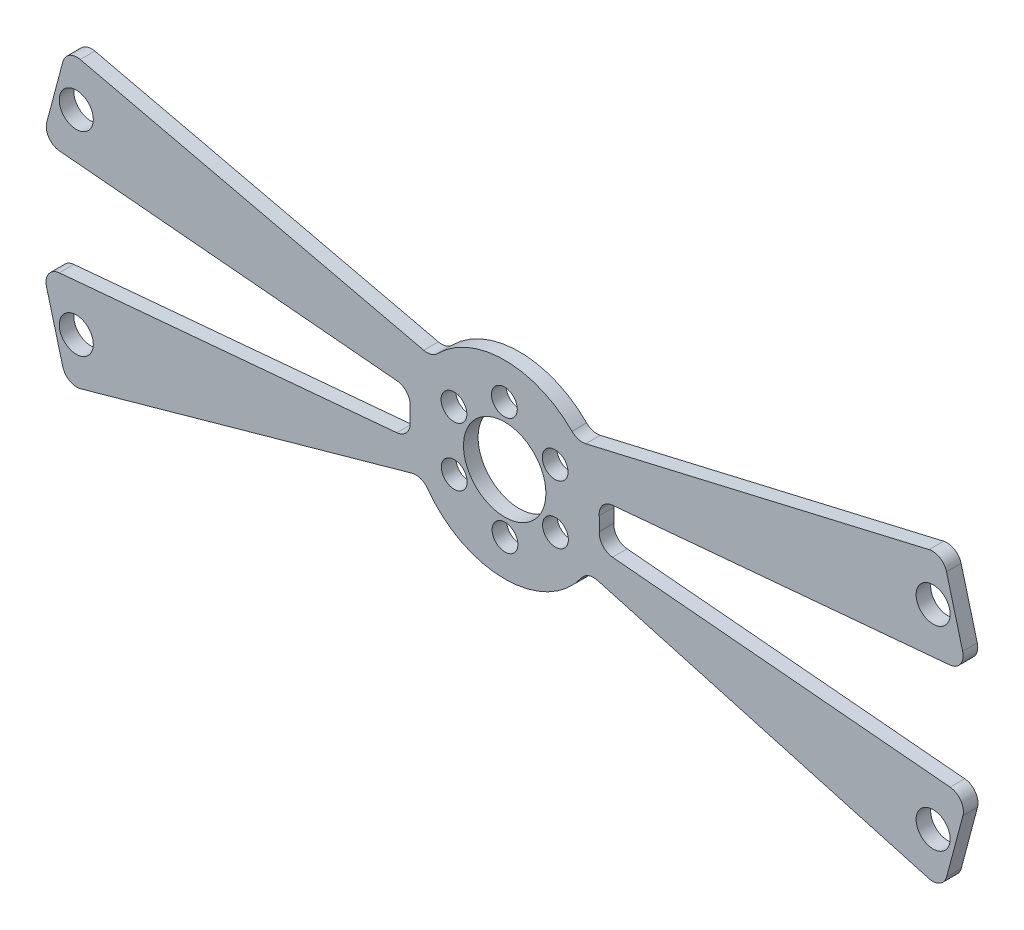
from build123d import *

# Parameters (mm, degrees)
EXTRUDE_2_DEPTH     = 3
SKETCH_4_R          = 3.5
SKETCH_4_R_2        = 8.462893534
CUT_EXTRUDE_1_DEPTH = 3


with BuildPart() as part:
    # 草图1 → 凸台-拉伸2 (new body)
    with BuildSketch(Plane.XY):
        with BuildLine():
            ThreePointArc((-41.460762065, 13.709335217), (-42.760990151, 12.93891125), (-44.271832455, 12.900159535))
            Line((-44.271832455, 12.900159535), (-114.804059861, 29.339622898))
            ThreePointArc((-114.804059861, 29.339622898), (-117.03015049, 28.989437599), (-118.384436325, 27.188321525))
            Line((-118.384436325, 27.188321525), (-121.701854382, 14.703033787))
            ThreePointArc((-121.701854382, 14.703033787), (-121.260080606, 12.212155416), (-119.070762209, 10.944668104))
            Line((-119.070762209, 10.944668104), (-49.770803206, 4.721894109))
            ThreePointArc((-49.770803206, 4.721894109), (-47.748446336, 3.671148438), (-47.048054184, 1.502405805))
            ThreePointArc((-47.048054184, 1.502405805), (-47.105933537, 0.083161809), (-47.060180936, -1.33652486))
            ThreePointArc((-47.060180936, -1.33652486), (-47.770737623, -3.489473399), (-49.784798606, -4.530452062))
            Line((-49.784798606, -4.530452062), (-119.120770315, -10.75645981))
            ThreePointArc((-119.120770315, -10.75645981), (-121.310088712, -12.023947122), (-121.751862488, -14.514825493))
            Line((-121.751862488, -14.514825493), (-118.417555824, -27.063674443))
            ThreePointArc((-118.417555824, -27.063674443), (-117.007145173, -28.897690671), (-114.711139436, -29.182701869))
            Line((-114.711139436, -29.182701869), (-46.713302844, -10.190770239))
            ThreePointArc((-46.713302844, -10.190770239), (-44.909974321, -10.250456004), (-43.467039159, -11.33373541))
            ThreePointArc((-43.467039159, -11.33373541), (-27.63735599, -19.468755163), (-11.807672821, -11.33373541))
            ThreePointArc((-11.807672821, -11.33373541), (-10.364737659, -10.250456004), (-8.561409136, -10.190770239))
            Line((-8.561409136, -10.190770239), (59.436427456, -29.182701869))
            ThreePointArc((59.436427456, -29.182701869), (61.732433193, -28.897690671), (63.142843844, -27.063674443))
            Line((63.142843844, -27.063674443), (66.477150508, -14.514825493))
            ThreePointArc((66.477150508, -14.514825493), (66.035376732, -12.023947122), (63.846058336, -10.75645981))
            Line((63.846058336, -10.75645981), (-5.489913373, -4.530452062))
            ThreePointArc((-5.489913373, -4.530452062), (-7.503974356, -3.489473399), (-8.214531044, -1.33652486))
            ThreePointArc((-8.214531044, -1.33652486), (-8.168778443, 0.083161809), (-8.226657796, 1.502405805))
            ThreePointArc((-8.226657796, 1.502405805), (-7.526265644, 3.671148438), (-5.503908774, 4.721894109))
            Line((-5.503908774, 4.721894109), (63.796050229, 10.944668104))
            ThreePointArc((63.796050229, 10.944668104), (65.985368626, 12.212155416), (66.427142402, 14.703033787))
            Line((66.427142402, 14.703033787), (63.109724345, 27.188321525))
            ThreePointArc((63.109724345, 27.188321525), (61.75543851, 28.989437599), (59.529347881, 29.339622898))
            Line((59.529347881, 29.339622898), (-11.002879525, 12.900159535))
            ThreePointArc((-11.002879525, 12.900159535), (-12.513721829, 12.93891125), (-13.813949915, 13.709335217))
            ThreePointArc((-13.813949915, 13.709335217), (-27.63735599, 19.468755163), (-41.460762065, 13.709335217))
        make_face()
    extrude(amount=EXTRUDE_2_DEPTH)

    # 草图4 → 切除-拉伸1 (cut)
    with BuildSketch(Plane.XY.offset(3)):
        with Locations((-115.63735599, -20)):
            Circle(SKETCH_4_R)
        with Locations((-115.63735599, 20)):
            Circle(SKETCH_4_R)
        with Locations((60.36264401, -20)):
            Circle(SKETCH_4_R)
        with Locations((60.36264401, 20)):
            Circle(SKETCH_4_R)
        with Locations((-27.63735599, 0)):
            Circle(SKETCH_4_R_2)
        with BuildLine():
            ThreePointArc((-37.984908909, -8.703484854), (-35.348611937, -6.039852319), (-38.012244471, -3.403555348))
            ThreePointArc((-38.012244471, -3.403555348), (-40.648541443, -6.067187882), (-37.984908909, -8.703484854))
        make_face()
        with BuildLine():
            ThreePointArc((-25.273693465, -13.312986121), (-26.26231842, -9.698069705), (-29.877234836, -10.68669466))
            ThreePointArc((-29.877234836, -10.68669466), (-28.888609881, -14.301611076), (-25.273693465, -13.312986121))
        make_face()
        with BuildLine():
            ThreePointArc((-19.502346355, -7.283139312), (-15.877424428, -8.234423195), (-14.926140546, -4.609501268))
            ThreePointArc((-14.926140546, -4.609501268), (-18.551062473, -3.658217385), (-19.502346355, -7.283139312))
        make_face()
        with BuildLine():
            ThreePointArc((-17.262467509, 3.403555348), (-14.626170537, 6.067187882), (-17.289803071, 8.703484854))
            ThreePointArc((-17.289803071, 8.703484854), (-19.926100043, 6.039852319), (-17.262467509, 3.403555348))
        make_face()
        with BuildLine():
            ThreePointArc((-25.397477144, 10.68669466), (-26.386102099, 14.301611076), (-30.001018515, 13.312986121))
            ThreePointArc((-30.001018515, 13.312986121), (-29.01239356, 9.698069705), (-25.397477144, 10.68669466))
        make_face()
        with BuildLine():
            ThreePointArc((-35.772365625, 7.283139312), (-39.397287552, 8.234423195), (-40.348571434, 4.609501268))
            ThreePointArc((-40.348571434, 4.609501268), (-36.723649507, 3.658217385), (-35.772365625, 7.283139312))
        make_face()
    extrude(amount=-CUT_EXTRUDE_1_DEPTH, mode=Mode.SUBTRACT)


solid = part.part
